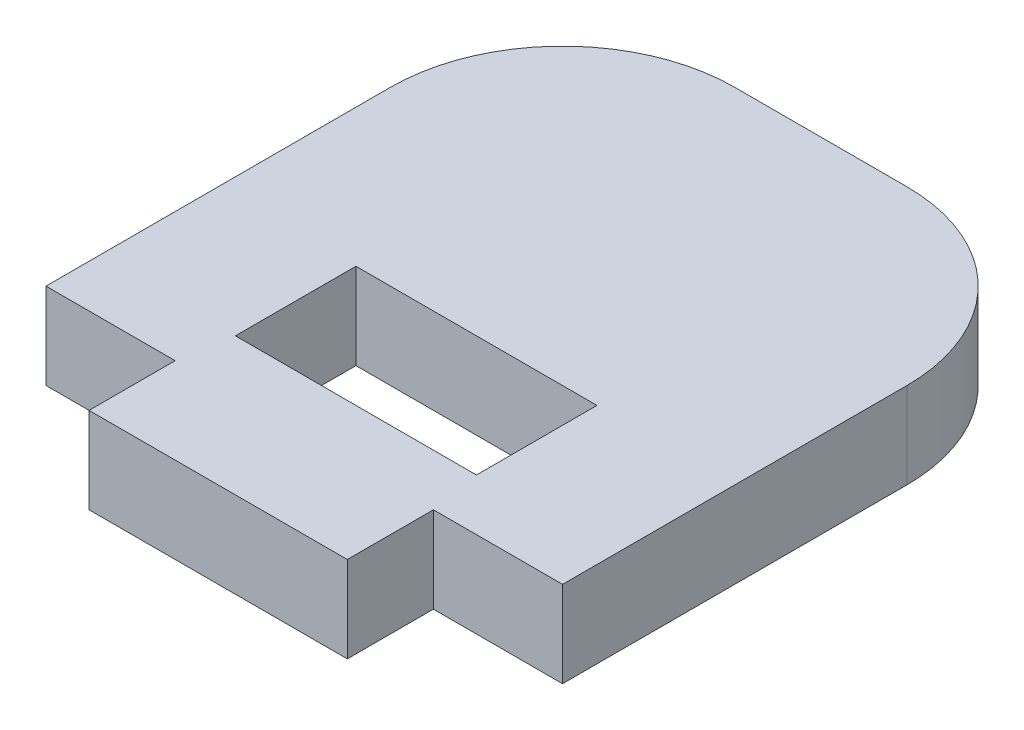
from build123d import *

# Parameters (mm, degrees)
BOSS_EXTRUDE1_DEPTH = 6.35
SKETCH2_W           = 17.78
SKETCH2_H           = 8.89
CUT_EXTRUDE1_DEPTH  = 6.35


with BuildPart() as part:
    # Sketch1 → Boss-Extrude1 (new body)
    with BuildSketch(Plane(origin=(0, 0, 0), x_dir=(1, 0, 0), z_dir=(0, 1, 0))):
        with BuildLine():
            Line((9.525, -3.175), (-9.525, -3.175))
            Line((-9.525, -3.175), (-9.525, 3.175))
            Line((-9.525, 3.175), (-19.05, 3.175))
            Line((-19.05, 3.175), (-19.05, 28.575))
            ThreePointArc((-19.05, 28.575), (-15.330256121, 37.555256121), (-6.35, 41.275))
            Line((-6.35, 41.275), (6.35, 41.275))
            ThreePointArc((6.35, 41.275), (15.330256121, 37.555256121), (19.05, 28.575))
            Line((19.05, 28.575), (19.05, 3.175))
            Line((19.05, 3.175), (9.525, 3.175))
            Line((9.525, 3.175), (9.525, -3.175))
        make_face()
    extrude(amount=BOSS_EXTRUDE1_DEPTH)

    # Sketch2 → Cut-Extrude1 (cut)
    with BuildSketch(Plane(origin=(0, 6.35, 0), x_dir=(1, 0, 0), z_dir=(0, 1, 0))):
        with Locations((0, 11.43)):
            Rectangle(SKETCH2_W, SKETCH2_H)
    extrude(amount=-CUT_EXTRUDE1_DEPTH, mode=Mode.SUBTRACT)


solid = part.part
